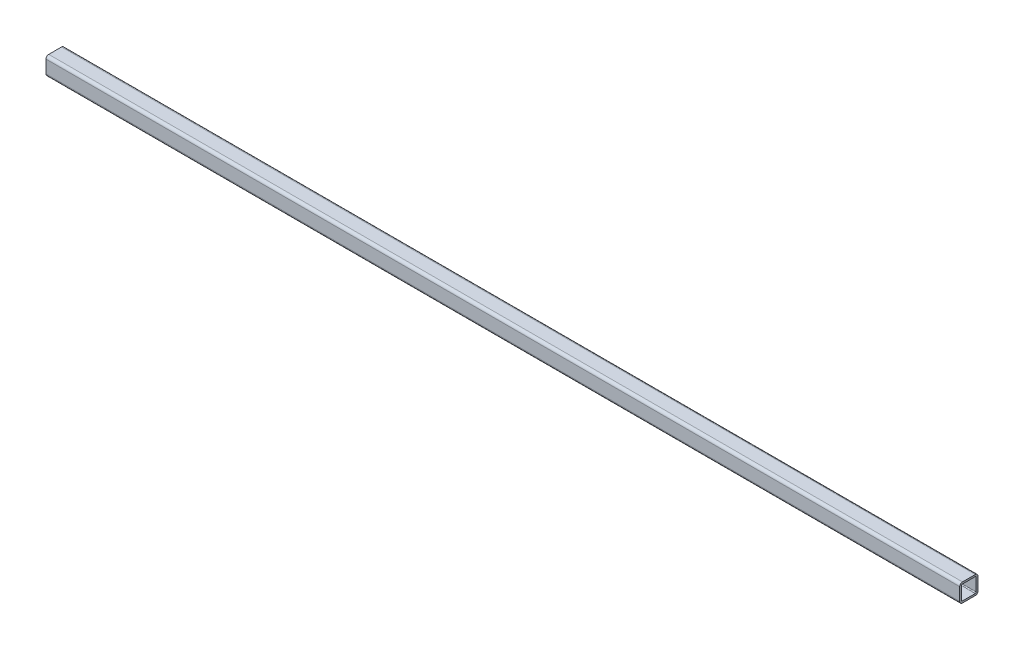
from build123d import *

# Parameters (mm, degrees)
EXTRUDE_1_DEPTH = 1000


with BuildPart() as part:
    # Эскиз1 → Вытянуть-Тонкостенный1 (new body)
    with BuildSketch(Plane(origin=(0, 0, 0), x_dir=(0, 0, -1), z_dir=(1, 0, 0))):
        with BuildLine():
            Line((-2, 15), (-2, 1))
            ThreePointArc((-2, 1), (-1.121320344, -1.121320344), (1, -2))
            Line((1, -2), (15, -2))
            ThreePointArc((15, -2), (17.121320344, -1.121320344), (18, 1))
            Line((18, 1), (18, 15))
            ThreePointArc((18, 15), (17.121320344, 17.121320344), (15, 18))
            Line((15, 18), (1, 18))
            ThreePointArc((1, 18), (-1.121320344, 17.121320344), (-2, 15))
        make_face()
        with BuildLine():
            Line((0, 15), (0, 1))
            ThreePointArc((0, 1), (0.292893219, 0.292893219), (1, 0))
            Line((1, 0), (15, 0))
            ThreePointArc((15, 0), (15.707106781, 0.292893219), (16, 1))
            Line((16, 1), (16, 15))
            ThreePointArc((16, 15), (15.707106781, 15.707106781), (15, 16))
            Line((15, 16), (1, 16))
            ThreePointArc((1, 16), (0.292893219, 15.707106781), (0, 15))
        make_face(mode=Mode.SUBTRACT)
    extrude(amount=EXTRUDE_1_DEPTH)


solid = part.part
